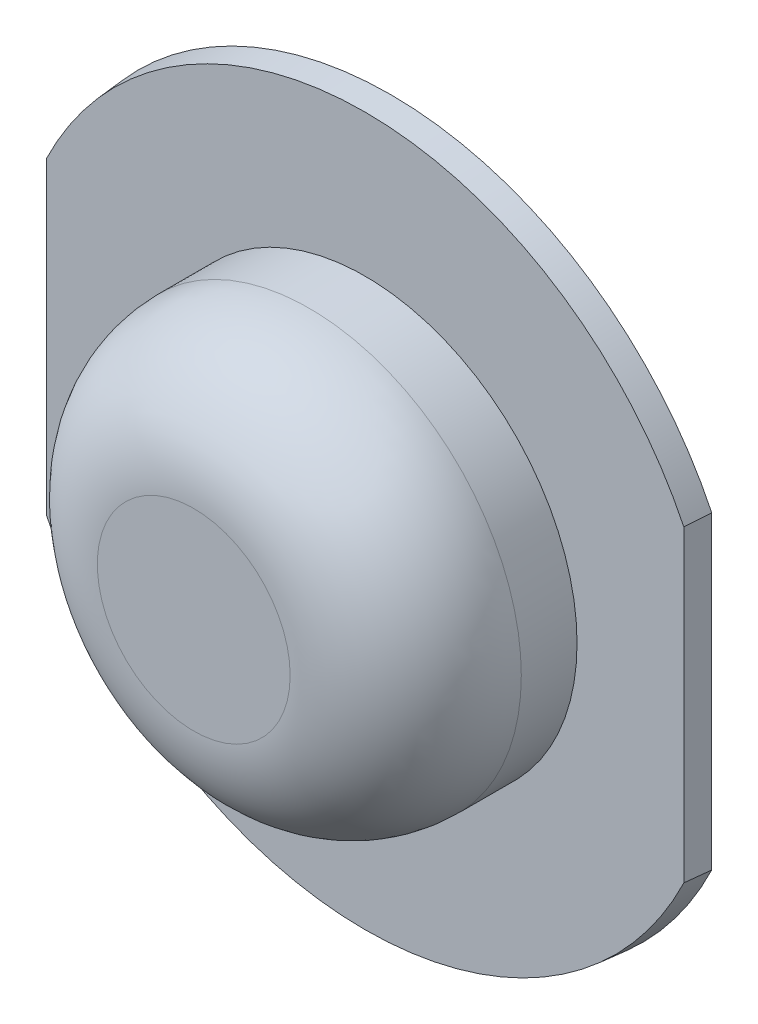
from build123d import *

# Parameters (mm, degrees)
BOSS_EXTRUDE1_DEPTH = 4
BOSS_EXTRUDE1_TAPER = 5
SKETCH6_W           = 52.54
SKETCH6_H           = 52.54
CUT_EXTRUDE2_DEPTH  = 2.35
CUT_EXTRUDE3_DEPTH  = 0.8
CIRPATTERN1_COUNT   = 4
SKETCH9_R           = 33.02
BOSS_EXTRUDE3_DEPTH = 26.68
FILLET2_R           = 18


with BuildPart() as part:
    # Sketch1 → Boss-Extrude1 (new body)
    with BuildSketch(Plane.XY):
        with BuildLine():
            ThreePointArc((50, 24.088378941), (0, 55.5), (-50, 24.088378941))
            Line((-50, 24.088378941), (-50, -24.088378941))
            ThreePointArc((-50, -24.088378941), (0, -55.5), (50, -24.088378941))
            Line((50, -24.088378941), (50, 24.088378941))
        make_face()
    extrude(amount=BOSS_EXTRUDE1_DEPTH, taper=BOSS_EXTRUDE1_TAPER)

    # Sketch6 → Cut-Extrude2 (cut)
    with BuildSketch(Plane(origin=(0, 0, 0), x_dir=(-1, 0, 0), z_dir=(0, 0, -1))):
        Rectangle(SKETCH6_W, SKETCH6_H)
    extrude(amount=-CUT_EXTRUDE2_DEPTH, mode=Mode.SUBTRACT)

    # Sketch7 → Cut-Revolve1 (revolve, cut)
    with BuildSketch(Plane(origin=(0, 0, 0), x_dir=(1, 0, 0), z_dir=(0, 1, 0))):
        with BuildLine():
            Line((0, -2.35), (0, -27.35))
            ThreePointArc((0, -27.35), (17.67766953, -20.02766953), (25, -2.35))
            Line((25, -2.35), (0, -2.35))
        make_face()
    revolve(axis=Axis((0, 0, 2.35), (0, 0, 1)), mode=Mode.SUBTRACT)

    # Sketch8 → Cut-Extrude3 (cut)
    with BuildSketch(Plane(origin=(0, 0, 2.35), x_dir=(-1, 0, 0), z_dir=(0, 0, -1))):
        with BuildLine():
            Line((-19.887048211, -15.149432777), (-15.149432777, -19.887048211))
            Line((-15.149432777, -19.887048211), (-17.801083206, -22.53869864))
            ThreePointArc((-17.801083206, -22.53869864), (-19.215296769, -23.124485078), (-20.629510331, -22.53869864))
            Line((-20.629510331, -22.53869864), (-22.53869864, -20.629510331))
            ThreePointArc((-22.53869864, -20.629510331), (-23.124485078, -19.215296769), (-22.53869864, -17.801083206))
            Line((-22.53869864, -17.801083206), (-19.887048211, -15.149432777))
        make_face()
    cut_extrude3 = extrude(amount=-CUT_EXTRUDE3_DEPTH, mode=Mode.SUBTRACT)

    # CirPattern1: Cut-Extrude3 ×4 about axis
    cirpattern1_axis = Axis((0, 0, 0), (0, 0, 1))
    for i in range(1, CIRPATTERN1_COUNT):
        add(cut_extrude3.rotate(cirpattern1_axis, i * 360 / CIRPATTERN1_COUNT), mode=Mode.SUBTRACT)

    # Sketch9 → Boss-Extrude3 (add)
    with BuildSketch(Plane.XY.offset(4)):
        Circle(SKETCH9_R)
    extrude(amount=BOSS_EXTRUDE3_DEPTH)

    # Fillet2
    fillet2_edges = [part.edges().sort_by_distance(p)[0] for p in [
        (-33.02, 0, 30.68),
    ]]
    fillet(fillet2_edges, radius=FILLET2_R)


solid = part.part
